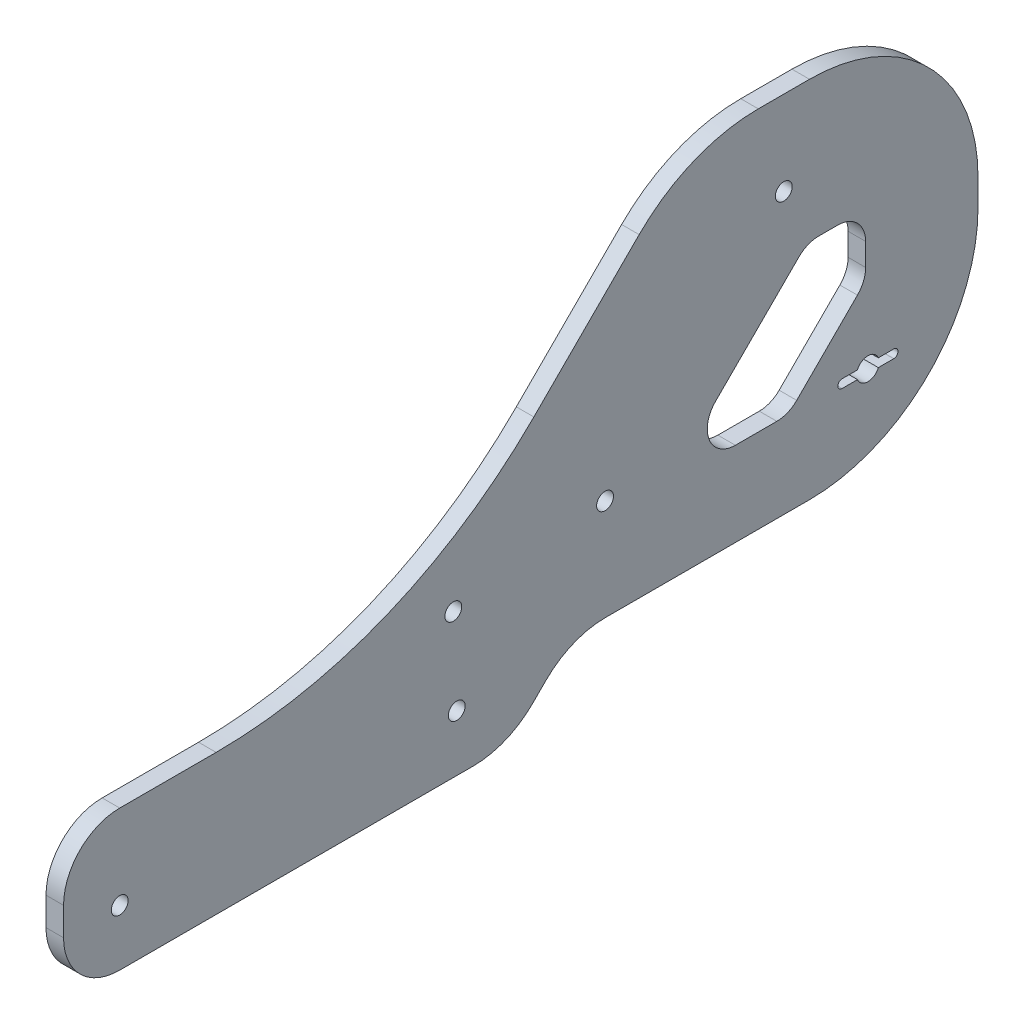
from build123d import *

# Parameters (mm, degrees)
SKETCH1_R           = 1.5
BOSS_EXTRUDE1_DEPTH = 3.125
FILLET1_R           = 10
FILLET2_R           = 15
FILLET3_R           = 30
FILLET4_R           = 30
FILLET5_R           = 80
FILLET6_R           = 30
FILLET7_R           = 5


with BuildPart() as part:
    # Sketch1 → Boss-Extrude1 (new body)
    with BuildSketch(Plane(origin=(0, 0, 0), x_dir=(0, 0, -1), z_dir=(1, 0, 0))):
        Polygon((-143.20422433, -1.13137085), (-143.20422433, -26.13137085), (-64.062088707, -26.13137085), (-52.930717857, -15), (19.6, -15), (19.6, 49.830569927), (-31.940768363, 49.830569927), (-82.90270914, -1.13137085), align=None)
        with Locations((-46.799347007, 3.010764774)):
            Circle(SKETCH1_R, mode=Mode.SUBTRACT)
        with Locations((-14.979541854, 34.830569927)):
            Circle(SKETCH1_R, mode=Mode.SUBTRACT)
        with Locations((-73.810826048, -0.524769132)):
            Circle(SKETCH1_R, mode=Mode.SUBTRACT)
        with Locations((-73.20422433, -16.13137085)):
            Circle(SKETCH1_R, mode=Mode.SUBTRACT)
        with Locations((-133.20422433, -16.13137085)):
            Circle(SKETCH1_R, mode=Mode.SUBTRACT)
        with BuildLine():
            Line((-4.6, 0.75), (-1.854049622, 0.75))
            ThreePointArc((-1.854049622, 0.75), (0, 2), (1.854049622, 0.75))
            Line((1.854049622, 0.75), (4.6, 0.75))
            ThreePointArc((4.6, 0.75), (5.35, 0), (4.6, -0.75))
            Line((4.6, -0.75), (1.854049622, -0.75))
            ThreePointArc((1.854049622, -0.75), (0, -2), (-1.854049622, -0.75))
            Line((-1.854049622, -0.75), (-4.6, -0.75))
            ThreePointArc((-4.6, -0.75), (-5.35, 0), (-4.6, 0.75))
        make_face(mode=Mode.SUBTRACT)
        Polygon((-35.667976157, 0), (-10.83740623, 24.830569927), (-0.4, 24.830569927), (-0.4, 13.742135624), (-14.142135624, 0), align=None, mode=Mode.SUBTRACT)
    extrude(amount=BOSS_EXTRUDE1_DEPTH)

    # Fillet1
    fillet1_edges = [part.edges().sort_by_distance(p)[0] for p in [
        (1.5625, -1.13137085, 143.20422433),
        (1.5625, -26.13137085, 143.20422433),
    ]]
    fillet(fillet1_edges, radius=FILLET1_R)

    # Fillet2
    fillet2_edges = [part.edges().sort_by_distance(p)[0] for p in [
        (1.5625, -26.13137085, 64.062088707),
        (1.5625, -15, 52.930717857),
    ]]
    fillet(fillet2_edges, radius=FILLET2_R)

    # Fillet3
    fillet3_edges = [part.edges().sort_by_distance(p)[0] for p in [
        (1.5625, -15, -19.6),
    ]]
    fillet(fillet3_edges, radius=FILLET3_R)

    # Fillet4
    fillet4_edges = [part.edges().sort_by_distance(p)[0] for p in [
        (1.5625, 49.830569927, 31.940768363),
    ]]
    fillet(fillet4_edges, radius=FILLET4_R)

    # Fillet5
    fillet5_edges = [part.edges().sort_by_distance(p)[0] for p in [
        (1.5625, -1.13137085, 82.90270914),
    ]]
    fillet(fillet5_edges, radius=FILLET5_R)

    # Fillet6
    fillet6_edges = [part.edges().sort_by_distance(p)[0] for p in [
        (1.5625, 49.830569927, -19.6),
    ]]
    fillet(fillet6_edges, radius=FILLET6_R)

    # Fillet7
    fillet7_edges = [part.edges().sort_by_distance(p)[0] for p in [
        (1.5625, 0, 35.667976157),
        (1.5625, 24.830569927, 10.83740623),
        (1.5625, 24.830569927, 0.4),
        (1.5625, 13.742135624, 0.4),
        (1.5625, 0, 14.142135624),
    ]]
    fillet(fillet7_edges, radius=FILLET7_R)


solid = part.part
